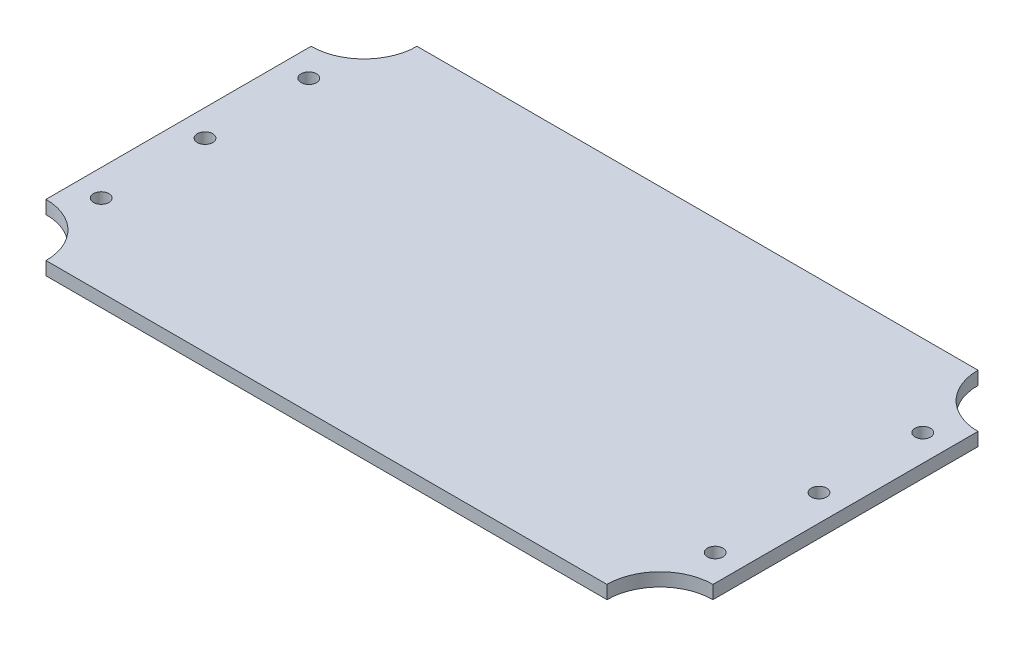
from build123d import *
from build123d.topology import SkipClean

# Parameters (mm, degrees)
SKETCH_2_R               = 4.5
EXTRUDE_1_DEPTH          = 8
EXTRUDE_2_DEPTH          = 4
EXTRUDE_2_DEPTH_BACK     = 11.5
CUT_EXTRUDE_1_DEPTH      = 41.717122437
CUT_EXTRUDE_1_DEPTH_BACK = 41.717122437
CUT_EXTRUDE_2_DEPTH      = 41.717122437
CUT_EXTRUDE_2_DEPTH_BACK = 41.717122437
SKETCH_6_R               = 1
SKETCH_7_R               = 1.75
EXTRUDE_3_DEPTH          = 3
EXTRUDE_4_DEPTH          = 5
SKETCH_9_R               = 1
CUT_EXTRUDE_3_DEPTH      = 5
SKETCH_10_R              = 3.5
SKETCH_10_R_2            = 1
EXTRUDE_5_DEPTH          = 4


with BuildPart() as part:
    # Эскиз2 → Бобышка-Вытянуть1 (new body)
    with BuildSketch(Plane.XY):
        with BuildLine():
            Line((-18.858561718, 18.044523082), (33.641438282, 18.044523082))
            ThreePointArc((33.641438282, 18.044523082), (34.348545063, 17.751629864), (34.641438282, 17.044523082))
            Line((34.641438282, 17.044523082), (34.641438282, 7.044523082))
            ThreePointArc((34.641438282, 7.044523082), (34.348545063, 6.337416301), (33.641438282, 6.044523082))
            Line((33.641438282, 6.044523082), (22.641438282, 6.044523082))
            ThreePointArc((22.641438282, 6.044523082), (19.105904376, 4.580056988), (17.641438282, 1.044523082))
            Line((17.641438282, 1.044523082), (17.641438282, -12.955476918))
            ThreePointArc((17.641438282, -12.955476918), (17.348545063, -13.662583699), (16.641438282, -13.955476918))
            Line((16.641438282, -13.955476918), (-9.858561718, -13.955476918))
            ThreePointArc((-9.858561718, -13.955476918), (-10.565668499, -13.662583699), (-10.858561718, -12.955476918))
            Line((-10.858561718, -12.955476918), (-10.858561718, 6.044523082))
            Line((-10.858561718, 6.044523082), (-17.858561718, 6.044523082))
            ThreePointArc((-17.858561718, 6.044523082), (-18.565668499, 6.337416301), (-18.858561718, 7.044523082))
            Line((-18.858561718, 7.044523082), (-18.858561718, 18.044523082))
        make_face()
        with Locations((-0.858561718, -3.955476918)):
            Circle(SKETCH_2_R, mode=Mode.SUBTRACT)
    extrude(amount=EXTRUDE_1_DEPTH)

    # Эскиз3 → Бобышка-Вытянуть2 (add, two sides: drawn at the far end of the back side and taken through both)
    with SkipClean():  # the faces are left unmerged after this step: merging them gives an invalid solid
        with BuildSketch(Plane.XY.offset(8).offset(-EXTRUDE_2_DEPTH_BACK)):
            with BuildLine():
                Line((27.141438282, 14.544523082), (27.141438282, 18.044523082))
                Line((27.141438282, 18.044523082), (33.141438282, 18.044523082))
                Line((33.141438282, 18.044523082), (33.141438282, 14.544523082))
                ThreePointArc((33.141438282, 14.544523082), (30.141438282, 11.544523082), (27.141438282, 14.544523082))
            make_face()
            with BuildLine():
                Line((-0.358561718, 14.544523082), (-0.358561718, 18.044523082))
                Line((-0.358561718, 18.044523082), (-6.358561718, 18.044523082))
                Line((-6.358561718, 18.044523082), (-6.358561718, 14.544523082))
                ThreePointArc((-6.358561718, 14.544523082), (-3.358561718, 11.544523082), (-0.358561718, 14.544523082))
            make_face()
            with BuildLine():
                Line((-6.358561718, -10.455476918), (-6.358561718, -13.955476918))
                Line((-6.358561718, -13.955476918), (-0.358561718, -13.955476918))
                Line((-0.358561718, -13.955476918), (-0.358561718, -10.455476918))
                ThreePointArc((-0.358561718, -10.455476918), (-0.519059003, -9.487373446), (-0.983377938, -8.622855294))
                ThreePointArc((-0.983377938, -8.622855294), (-1.135599023, -8.491670945), (-1.327173883, -8.4310107))
                ThreePointArc((-1.327173883, -8.4310107), (-2.473967575, -8.155532145), (-3.509794913, -7.591541073))
                ThreePointArc((-3.509794913, -7.591541073), (-3.692643427, -7.508192328), (-3.893539312, -7.503562458))
                ThreePointArc((-3.893539312, -7.503562458), (-5.661270208, -8.532579726), (-6.358561718, -10.455476918))
            make_face()
        extrude(amount=EXTRUDE_2_DEPTH + EXTRUDE_2_DEPTH_BACK)
    add(part.part.scale(1), mode=Mode.REPLACE)  # the faces are merged on a copy

    # Эскиз5 → Вырез-Вытянуть1 (cut, two sides: drawn at the far end of the back side and taken through both)
    with BuildSketch(Plane.XY.offset(8).offset(-CUT_EXTRUDE_1_DEPTH_BACK)):
        with BuildLine():
            Line((8.520862779, 6.560547497), (2.520862779, 6.560547497))
            ThreePointArc((2.520862779, 6.560547497), (0.399542436, 5.681867841), (-0.479137221, 3.560547497))
            Line((-0.479137221, 3.560547497), (-0.479137221, -8.439452503))
            Line((-0.479137221, -8.439452503), (8.520862779, -8.439452503))
            ThreePointArc((8.520862779, -8.439452503), (10.642183123, -7.560772847), (11.520862779, -5.439452503))
            Line((11.520862779, -5.439452503), (11.520862779, 3.560547497))
            ThreePointArc((11.520862779, 3.560547497), (10.642183123, 5.681867841), (8.520862779, 6.560547497))
        make_face()
    extrude(amount=CUT_EXTRUDE_1_DEPTH + CUT_EXTRUDE_1_DEPTH_BACK, mode=Mode.SUBTRACT)

    # Эскиз6 → Вырез-Вытянуть2 (cut, two sides: drawn at the far end of the back side and taken through both)
    with BuildSketch(Plane.XY.offset(8).offset(-CUT_EXTRUDE_2_DEPTH_BACK)):
        with Locations((-3.358561718, 14.544523082)):
            Circle(SKETCH_6_R)
        with Locations((30.141438282, 14.544523082)):
            Circle(SKETCH_6_R)
        with Locations((-3.358561718, -10.455476918)):
            Circle(SKETCH_6_R)
    extrude(amount=CUT_EXTRUDE_2_DEPTH + CUT_EXTRUDE_2_DEPTH_BACK, mode=Mode.SUBTRACT)

    # Эскиз7 → Бобышка-Вытянуть3 (add)
    with BuildSketch(Plane(origin=(0, 18.044523082, 0), x_dir=(1, 0, 0), z_dir=(0, 1, 0))):
        with BuildLine():
            Line((-31.858561718, 15.5), (95.141438282, 15.5))
            ThreePointArc((95.141438282, 15.5), (98.656156908, 7.014718626), (107.141438282, 3.5))
            Line((107.141438282, 3.5), (107.141438282, -56.5))
            ThreePointArc((107.141438282, -56.5), (98.656156908, -60.014718626), (95.141438282, -68.5))
            Line((95.141438282, -68.5), (-31.858561718, -68.5))
            ThreePointArc((-31.858561718, -68.5), (-35.373280344, -60.014718626), (-43.858561718, -56.5))
            Line((-43.858561718, -56.5), (-43.858561718, 3.5))
            ThreePointArc((-43.858561718, 3.5), (-35.373280344, 7.014718626), (-31.858561718, 15.5))
        make_face()
        with Locations((-37.858561718, -26.5)):
            Circle(SKETCH_7_R, mode=Mode.SUBTRACT)
        with Locations((-37.858561718, -50)):
            Circle(SKETCH_7_R, mode=Mode.SUBTRACT)
        with Locations((-37.858561718, -3)):
            Circle(SKETCH_7_R, mode=Mode.SUBTRACT)
        with Locations((101.141438282, -50)):
            Circle(SKETCH_7_R, mode=Mode.SUBTRACT)
        with Locations((101.141438282, -26.5)):
            Circle(SKETCH_7_R, mode=Mode.SUBTRACT)
        with Locations((101.141438282, -3)):
            Circle(SKETCH_7_R, mode=Mode.SUBTRACT)
    extrude(amount=EXTRUDE_3_DEPTH)

    # Эскиз8 → Бобышка-Вытянуть4 (add)
    with BuildSketch(Plane.XZ.offset(-18.044523082)):
        with BuildLine():
            Line((90.141438282, 31), (44.141438282, 31))
            ThreePointArc((44.141438282, 31), (42.72722472, 30.414213562), (42.141438282, 29))
            Line((42.141438282, 29), (42.141438282, 28))
            ThreePointArc((42.141438282, 28), (42.72722472, 26.585786438), (44.141438282, 26))
            Line((44.141438282, 26), (90.141438282, 26))
            ThreePointArc((90.141438282, 26), (91.555651845, 26.585786438), (92.141438282, 28))
            Line((92.141438282, 28), (92.141438282, 29))
            ThreePointArc((92.141438282, 29), (91.555651845, 30.414213562), (90.141438282, 31))
        make_face()
    extrude(amount=EXTRUDE_4_DEPTH)

    # Эскиз9 → Вырез-Вытянуть3 (cut)
    with BuildSketch(Plane.XZ.offset(-13.044523082)):
        with Locations((67.141438282, 28.5)):
            Circle(SKETCH_9_R)
        with Locations((72.141438282, 28.5)):
            Circle(SKETCH_9_R)
        with Locations((77.141438282, 28.5)):
            Circle(SKETCH_9_R)
        with Locations((82.141438282, 28.5)):
            Circle(SKETCH_9_R)
        with Locations((87.141438282, 28.5)):
            Circle(SKETCH_9_R)
        with Locations((47.141438282, 28.5)):
            Circle(SKETCH_9_R)
        with Locations((52.141438282, 28.5)):
            Circle(SKETCH_9_R)
        with Locations((57.141438282, 28.5)):
            Circle(SKETCH_9_R)
        with Locations((62.141438282, 28.5)):
            Circle(SKETCH_9_R)
    extrude(amount=-CUT_EXTRUDE_3_DEPTH, mode=Mode.SUBTRACT)

    # Эскиз10 → Бобышка-Вытянуть5 (add)
    # profile 1 of 6: a face of its own
    with BuildSketch(Plane.XZ.offset(-18.044523082)):
        with Locations((32.641438282, 55)):
            Circle(SKETCH_10_R)
        with Locations((32.641438282, 55)):
            Circle(SKETCH_10_R_2, mode=Mode.SUBTRACT)
    # profile 2 of 6: a face of its own
    with BuildSketch(Plane.XZ.offset(-18.044523082)):
        with Locations((63.641438282, 39)):
            Circle(SKETCH_10_R)
        with Locations((63.641438282, 39)):
            Circle(SKETCH_10_R_2, mode=Mode.SUBTRACT)
    # profile 3 of 6: a face of its own
    with BuildSketch(Plane.XZ.offset(-18.044523082)):
        with Locations((-28.258561718, 54)):
            Circle(SKETCH_10_R)
        with Locations((-28.258561718, 54)):
            Circle(SKETCH_10_R_2, mode=Mode.SUBTRACT)
    # profile 4 of 6: a face of its own
    with BuildSketch(Plane.XZ.offset(-18.044523082)):
        with Locations((14.541438282, 54)):
            Circle(SKETCH_10_R)
        with Locations((14.541438282, 54)):
            Circle(SKETCH_10_R_2, mode=Mode.SUBTRACT)
    # profile 5 of 6: a face of its own
    with BuildSketch(Plane.XZ.offset(-18.044523082)):
        with Locations((14.541438282, 33)):
            Circle(SKETCH_10_R)
        with Locations((14.541438282, 33)):
            Circle(SKETCH_10_R_2, mode=Mode.SUBTRACT)
    # profile 6 of 6: a face of its own
    with BuildSketch(Plane.XZ.offset(-18.044523082)):
        with Locations((-28.258561718, 33)):
            Circle(SKETCH_10_R)
        with Locations((-28.258561718, 33)):
            Circle(SKETCH_10_R_2, mode=Mode.SUBTRACT)
    extrude(amount=EXTRUDE_5_DEPTH)


solid = part.part
